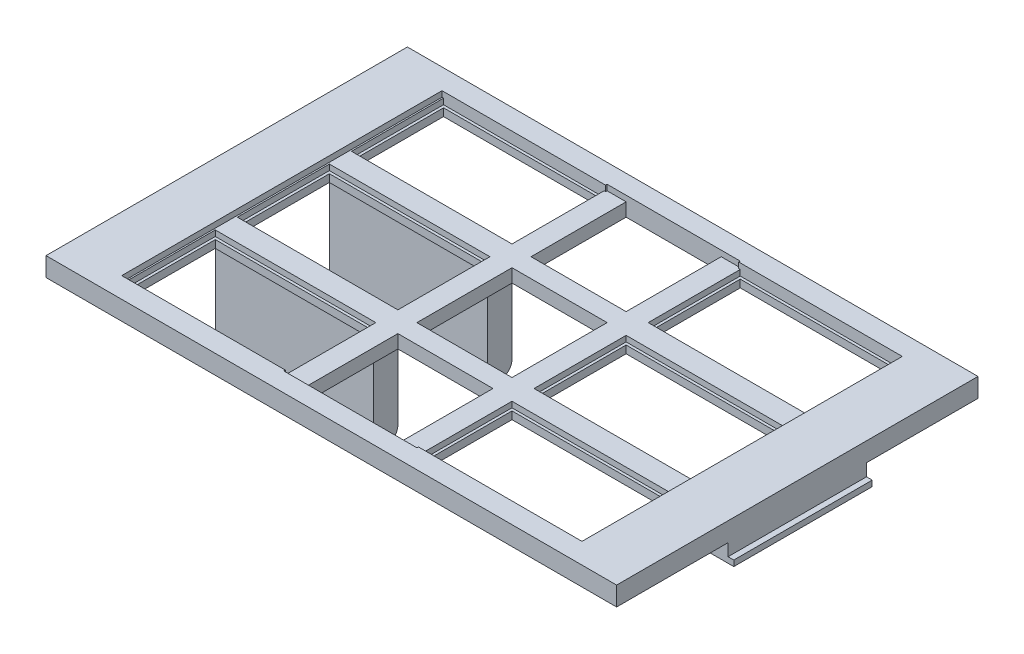
from build123d import *

# Parameters (mm, degrees)
SKETCH1_W            = 140
SKETCH1_H            = 95
SKETCH1_W_2          = 111
SKETCH1_H_2          = 85
BOSS_EXTRUDE1_DEPTH  = 5
SKETCH2_W            = 5
SKETCH2_H            = 85
CUT_EXTRUDE1_DEPTH   = 5
SKETCH3_W            = 25
SKETCH3_H            = 25
BOSS_EXTRUDE2_DEPTH  = 3.5
SKETCH4_W            = 43
SKETCH4_H            = 25
SKETCH4_W_2          = 41.6
SKETCH4_H_2          = 23.6
BOSS_EXTRUDE3_DEPTH  = 2
SKETCH7_W            = 5
SKETCH7_H            = 36.4
BOSS_EXTRUDE6_DEPTH  = 2.2
SKETCH8_W            = 7
SKETCH8_H            = 38.4
BOSS_EXTRUDE7_DEPTH  = 1
SKETCH9_W            = 41.6
SKETCH9_H            = 6.4
BOSS_EXTRUDE8_DEPTH  = 23
BOSS_EXTRUDE9_DEPTH  = 41.6
CUT_EXTRUDE2_DEPTH   = 3.2
SKETCH13_W           = 5
SKETCH13_H           = 95
BOSS_EXTRUDE10_DEPTH = 5
SKETCH14_W           = 5
SKETCH14_H           = 36.4
BOSS_EXTRUDE11_DEPTH = 2.2
SKETCH15_W           = 7
SKETCH15_H           = 36.4
BOSS_EXTRUDE13_DEPTH = 1
SKETCH16_W           = 1
SKETCH16_H           = 36.4
CUT_EXTRUDE3_DEPTH   = 1.5
SKETCH17_W           = 1
SKETCH17_H           = 36.4
CUT_EXTRUDE4_DEPTH   = 1.5
SKETCH18_W           = 8
SKETCH18_H           = 36.4
BOSS_EXTRUDE14_DEPTH = 1.5
SKETCH19_W           = 43
SKETCH19_H           = 0.4
BOSS_EXTRUDE15_DEPTH = 3
SKETCH20_W           = 43
SKETCH20_H           = 0.4
CUT_EXTRUDE5_DEPTH   = 1.5
SKETCH21_W           = 0.4
SKETCH21_H           = 24.2
BOSS_EXTRUDE16_DEPTH = 1.5
SKETCH22_W           = 0.4
SKETCH22_H           = 23.6
BOSS_EXTRUDE17_DEPTH = 2
SKETCH23_W           = 40.8
SKETCH23_H           = 0.4
BOSS_EXTRUDE18_DEPTH = 2


with BuildPart() as part:
    # Sketch1 → Boss-Extrude1 (new body)
    with BuildSketch(Plane(origin=(0, 0, 0), x_dir=(1, 0, 0), z_dir=(0, 1, 0))):
        with Locations((83.563791621, 53.12756541)):
            Rectangle(SKETCH1_W, SKETCH1_H)
        with Locations((83.563791621, 53.12756541)):
            Rectangle(SKETCH1_W_2, SKETCH1_H_2, mode=Mode.SUBTRACT)
    extrude(amount=BOSS_EXTRUDE1_DEPTH)

    # Sketch2 → Cut-Extrude1 (cut)
    with BuildSketch(Plane(origin=(0, 0, 0), x_dir=(-1, 0, 0), z_dir=(0, -1, 0))):
        with Locations((-25.563791621, 53.12756541)):
            Rectangle(SKETCH2_W, SKETCH2_H)
        with Locations((-141.563791621, 53.12756541)):
            Rectangle(SKETCH2_W, SKETCH2_H)
    extrude(amount=-CUT_EXTRUDE1_DEPTH, mode=Mode.SUBTRACT)

    # Sketch3 → Boss-Extrude2 (add)
    with BuildSketch(Plane(origin=(0, 0, 0), x_dir=(-1, 0, 0), z_dir=(0, -1, 0))):
        Polygon((-144.063791621, 65.62756541), (-101.063791621, 65.62756541), (-101.063791621, 40.62756541), (-144.063791621, 40.62756541), (-144.063791621, 35.62756541), (-101.063791621, 35.62756541), (-101.063791621, 10.62756541), (-96.063791621, 10.62756541), (-96.063791621, 35.62756541), (-71.063791621, 35.62756541), (-71.063791621, 10.62756541), (-66.063791621, 10.62756541), (-66.063791621, 35.62756541), (-23.063791621, 35.62756541), (-23.063791621, 40.62756541), (-66.063791621, 40.62756541), (-66.063791621, 65.62756541), (-23.063791621, 65.62756541), (-23.063791621, 70.62756541), (-66.063791621, 70.62756541), (-66.063791621, 95.62756541), (-71.063791621, 95.62756541), (-71.063791621, 70.62756541), (-96.063791621, 70.62756541), (-96.063791621, 95.62756541), (-101.063791621, 95.62756541), (-101.063791621, 70.62756541), (-144.063791621, 70.62756541), align=None)
        with Locations((-83.563791621, 53.12756541)):
            Rectangle(SKETCH3_W, SKETCH3_H, mode=Mode.SUBTRACT)
    extrude(amount=-BOSS_EXTRUDE2_DEPTH)

    # Sketch4 → Boss-Extrude3 (add)
    # profile 1 of 6: a face of its own
    with BuildSketch(Plane(origin=(0, 0, 0), x_dir=(-1, 0, 0), z_dir=(0, -1, 0))):
        with Locations((-44.563791621, 23.12756541)):
            Rectangle(SKETCH4_W, SKETCH4_H)
        with Locations((-44.563791621, 23.12756541)):
            Rectangle(SKETCH4_W_2, SKETCH4_H_2, mode=Mode.SUBTRACT)
    # profile 2 of 6: a face of its own
    with BuildSketch(Plane(origin=(0, 0, 0), x_dir=(-1, 0, 0), z_dir=(0, -1, 0))):
        with Locations((-44.563791621, 83.12756541)):
            Rectangle(SKETCH4_W, SKETCH4_H)
        with Locations((-44.563791621, 83.12756541)):
            Rectangle(SKETCH4_W_2, SKETCH4_H_2, mode=Mode.SUBTRACT)
    # profile 3 of 6: a face of its own
    with BuildSketch(Plane(origin=(0, 0, 0), x_dir=(-1, 0, 0), z_dir=(0, -1, 0))):
        with Locations((-122.563791621, 23.12756541)):
            Rectangle(SKETCH4_W, SKETCH4_H)
        with Locations((-122.563791621, 23.12756541)):
            Rectangle(SKETCH4_W_2, SKETCH4_H_2, mode=Mode.SUBTRACT)
    # profile 4 of 6: a face of its own
    with BuildSketch(Plane(origin=(0, 0, 0), x_dir=(-1, 0, 0), z_dir=(0, -1, 0))):
        with Locations((-122.563791621, 83.12756541)):
            Rectangle(SKETCH4_W, SKETCH4_H)
        with Locations((-122.563791621, 83.12756541)):
            Rectangle(SKETCH4_W_2, SKETCH4_H_2, mode=Mode.SUBTRACT)
    # profile 5 of 6: a face of its own
    with BuildSketch(Plane(origin=(0, 0, 0), x_dir=(-1, 0, 0), z_dir=(0, -1, 0))):
        with Locations((-122.563791621, 53.12756541)):
            Rectangle(SKETCH4_W, SKETCH4_H)
        with Locations((-122.563791621, 53.12756541)):
            Rectangle(SKETCH4_W_2, SKETCH4_H_2, mode=Mode.SUBTRACT)
    # profile 6 of 6: a face of its own
    with BuildSketch(Plane(origin=(0, 0, 0), x_dir=(-1, 0, 0), z_dir=(0, -1, 0))):
        with Locations((-44.563791621, 53.12756541)):
            Rectangle(SKETCH4_W, SKETCH4_H)
        with Locations((-44.563791621, 53.12756541)):
            Rectangle(SKETCH4_W_2, SKETCH4_H_2, mode=Mode.SUBTRACT)
    extrude(amount=-BOSS_EXTRUDE3_DEPTH)

    # Sketch7 → Boss-Extrude6 (add)
    with BuildSketch(Plane(origin=(0, 0, 0), x_dir=(-1, 0, 0), z_dir=(0, -1, 0))):
        with Locations((-16.063791621, 53.12756541)):
            Rectangle(SKETCH7_W, SKETCH7_H)
        with Locations((-151.063791621, 53.12756541)):
            Rectangle(SKETCH7_W, SKETCH7_H)
    extrude(amount=BOSS_EXTRUDE6_DEPTH)

    # Sketch8 → Boss-Extrude7 (add)
    with BuildSketch(Plane(origin=(0, -2.2, 0), x_dir=(-1, 0, 0), z_dir=(0, -1, 0))):
        with Locations((-16.063791621, 53.12756541)):
            Rectangle(SKETCH8_W, SKETCH8_H)
        with Locations((-151.063791621, 53.12756541)):
            Rectangle(SKETCH8_W, SKETCH8_H)
    extrude(amount=BOSS_EXTRUDE7_DEPTH)

    # Sketch9 → Boss-Extrude8 (add)
    with BuildSketch(Plane(origin=(0, 0, 0), x_dir=(-1, 0, 0), z_dir=(0, -1, 0))):
        with Locations((-44.563791621, 38.12756541)):
            Rectangle(SKETCH9_W, SKETCH9_H)
        with Locations((-44.563791621, 68.12756541)):
            Rectangle(SKETCH9_W, SKETCH9_H)
    extrude(amount=BOSS_EXTRUDE8_DEPTH)

    # Sketch10 → Boss-Extrude9 (add)
    with BuildSketch(Plane.ZY.offset(-23.763791621)):
        with BuildLine():
            Line((-34.92756541, -23), (-41.32756541, -23))
            ThreePointArc((-41.32756541, -23), (-38.12756541, -26.2), (-34.92756541, -23))
        make_face()
        with BuildLine():
            Line((-64.92756541, -23), (-71.32756541, -23))
            ThreePointArc((-71.32756541, -23), (-68.12756541, -26.2), (-64.92756541, -23))
        make_face()
    extrude(amount=-BOSS_EXTRUDE9_DEPTH)

    # Sketch11 → Cut-Extrude2 (cut)
    with BuildSketch(Plane(origin=(0, -3.2, 0), x_dir=(-1, 0, 0), z_dir=(0, -1, 0))):
        Polygon((4.731224124, 21.307801326), (0, 88.568907634), (-22.49756263, 88.568907634), (-22.49756263, 20.976895931), align=None)
        Polygon((-171.539261376, 88.568907634), (-162.261867402, 19.278371394), (-145.542505007, 19.48155809), (-145.542505007, 88.568907634), align=None)
    extrude(amount=-CUT_EXTRUDE2_DEPTH, mode=Mode.SUBTRACT)

    # Sketch13 → Boss-Extrude10 (add)
    with BuildSketch(Plane(origin=(0, 0, 0), x_dir=(-1, 0, 0), z_dir=(0, -1, 0))):
        with Locations((-11.063791621, 53.12756541)):
            Rectangle(SKETCH13_W, SKETCH13_H)
        with Locations((-156.063791621, 53.12756541)):
            Rectangle(SKETCH13_W, SKETCH13_H)
    extrude(amount=-BOSS_EXTRUDE10_DEPTH)

    # Sketch14 → Boss-Extrude11 (add)
    with BuildSketch(Plane(origin=(0, 0, 0), x_dir=(-1, 0, 0), z_dir=(0, -1, 0))):
        with Locations((-11.063791621, 53.12756541)):
            Rectangle(SKETCH14_W, SKETCH14_H)
        with Locations((-156.063791621, 53.12756541)):
            Rectangle(SKETCH14_W, SKETCH14_H)
    extrude(amount=BOSS_EXTRUDE11_DEPTH)

    # Sketch15 → Boss-Extrude13 (add)
    with BuildSketch(Plane(origin=(0, -2.2, 0), x_dir=(-1, 0, 0), z_dir=(0, -1, 0))):
        with Locations((-156.063791621, 53.12756541)):
            Rectangle(SKETCH15_W, SKETCH15_H)
        with Locations((-11.063791621, 53.12756541)):
            Rectangle(SKETCH15_W, SKETCH15_H)
    extrude(amount=BOSS_EXTRUDE13_DEPTH)

    # Sketch16 → Cut-Extrude3 (cut)
    with BuildSketch(Plane(origin=(158.563791621, -2.2, -71.32756541), x_dir=(1, 0, 0), z_dir=(0, 1, 0))):
        with Locations((0.5, -18.2)):
            Rectangle(SKETCH16_W, SKETCH16_H)
        with Locations((-5.5, -18.2)):
            Rectangle(SKETCH16_W, SKETCH16_H)
    extrude(amount=-CUT_EXTRUDE3_DEPTH, mode=Mode.SUBTRACT)

    # Sketch17 → Cut-Extrude4 (cut)
    with BuildSketch(Plane(origin=(0, -3.2, 0), x_dir=(-1, 0, 0), z_dir=(0, -1, 0))):
        with Locations((-8.063791621, 53.12756541)):
            Rectangle(SKETCH17_W, SKETCH17_H)
        with Locations((-14.063791621, 53.12756541)):
            Rectangle(SKETCH17_W, SKETCH17_H)
    extrude(amount=-CUT_EXTRUDE4_DEPTH, mode=Mode.SUBTRACT)

    # Sketch18 → Boss-Extrude14 (add)
    with BuildSketch(Plane(origin=(0, -3.2, 0), x_dir=(-1, 0, 0), z_dir=(0, -1, 0))):
        with Locations((-11.063791621, 53.12756541)):
            Rectangle(SKETCH18_W, SKETCH18_H)
        with Locations((-156.063791621, 53.12756541)):
            Rectangle(SKETCH18_W, SKETCH18_H)
    extrude(amount=BOSS_EXTRUDE14_DEPTH)

    # Sketch19 → Boss-Extrude15 (add)
    with BuildSketch(Plane(origin=(0, 2, 0), x_dir=(1, 0, 0), z_dir=(0, 1, 0))):
        with Locations((44.563791621, 95.42756541)):
            Rectangle(SKETCH19_W, SKETCH19_H)
        with Locations((122.563791621, 95.42756541)):
            Rectangle(SKETCH19_W, SKETCH19_H)
        with Locations((44.563791621, 70.82756541)):
            Rectangle(SKETCH19_W, SKETCH19_H)
        with Locations((122.563791621, 70.82756541)):
            Rectangle(SKETCH19_W, SKETCH19_H)
        with Locations((122.563791621, 65.42756541)):
            Rectangle(SKETCH19_W, SKETCH19_H)
        with Locations((122.563791621, 40.82756541)):
            Rectangle(SKETCH19_W, SKETCH19_H)
        with Locations((122.563791621, 35.42756541)):
            Rectangle(SKETCH19_W, SKETCH19_H)
        with Locations((122.563791621, 10.82756541)):
            Rectangle(SKETCH19_W, SKETCH19_H)
        with Locations((44.563791621, 35.42756541)):
            Rectangle(SKETCH19_W, SKETCH19_H)
        with Locations((44.563791621, 10.82756541)):
            Rectangle(SKETCH19_W, SKETCH19_H)
        with Locations((44.563791621, 65.42756541)):
            Rectangle(SKETCH19_W, SKETCH19_H)
        with Locations((44.563791621, 40.82756541)):
            Rectangle(SKETCH19_W, SKETCH19_H)
    extrude(amount=BOSS_EXTRUDE15_DEPTH)

    # Sketch20 → Cut-Extrude5 (cut)
    with BuildSketch(Plane(origin=(0, 5, 0), x_dir=(1, 0, 0), z_dir=(0, 1, 0))):
        with Locations((44.563791621, 70.82756541)):
            Rectangle(SKETCH20_W, SKETCH20_H)
        with Locations((44.563791621, 65.42756541)):
            Rectangle(SKETCH20_W, SKETCH20_H)
        with Locations((122.563791621, 70.82756541)):
            Rectangle(SKETCH20_W, SKETCH20_H)
        with Locations((122.563791621, 65.42756541)):
            Rectangle(SKETCH20_W, SKETCH20_H)
        with Locations((122.563791621, 40.82756541)):
            Rectangle(SKETCH20_W, SKETCH20_H)
        with Locations((122.563791621, 35.42756541)):
            Rectangle(SKETCH20_W, SKETCH20_H)
        with Locations((44.563791621, 35.42756541)):
            Rectangle(SKETCH20_W, SKETCH20_H)
        with Locations((44.563791621, 40.82756541)):
            Rectangle(SKETCH20_W, SKETCH20_H)
    extrude(amount=-CUT_EXTRUDE5_DEPTH, mode=Mode.SUBTRACT)

    # Sketch21 → Boss-Extrude16 (add)
    with BuildSketch(Plane(origin=(0, 2, 0), x_dir=(1, 0, 0), z_dir=(0, 1, 0))):
        with Locations((65.863791621, 83.12756541)):
            Rectangle(SKETCH21_W, SKETCH21_H)
        with Locations((23.263791621, 83.12756541)):
            Rectangle(SKETCH21_W, SKETCH21_H)
        with Locations((143.863791621, 83.12756541)):
            Rectangle(SKETCH21_W, SKETCH21_H)
        with Locations((101.263791621, 83.12756541)):
            Rectangle(SKETCH21_W, SKETCH21_H)
        with Locations((143.863791621, 53.12756541)):
            Rectangle(SKETCH21_W, SKETCH21_H)
        with Locations((101.263791621, 53.12756541)):
            Rectangle(SKETCH21_W, SKETCH21_H)
        with Locations((143.863791621, 23.12756541)):
            Rectangle(SKETCH21_W, SKETCH21_H)
        with Locations((101.263791621, 23.12756541)):
            Rectangle(SKETCH21_W, SKETCH21_H)
        with Locations((65.863791621, 23.12756541)):
            Rectangle(SKETCH21_W, SKETCH21_H)
        with Locations((23.263791621, 23.12756541)):
            Rectangle(SKETCH21_W, SKETCH21_H)
        with Locations((65.863791621, 53.12756541)):
            Rectangle(SKETCH21_W, SKETCH21_H)
        with Locations((23.263791621, 53.12756541)):
            Rectangle(SKETCH21_W, SKETCH21_H)
    extrude(amount=BOSS_EXTRUDE16_DEPTH)

    # Sketch22 → Boss-Extrude17 (add)
    with BuildSketch(Plane(origin=(0, 2, 0), x_dir=(1, 0, 0), z_dir=(0, 1, 0))):
        with Locations((65.163791621, 83.12756541)):
            Rectangle(SKETCH22_W, SKETCH22_H)
        with Locations((23.963791621, 83.12756541)):
            Rectangle(SKETCH22_W, SKETCH22_H)
        with Locations((143.163791621, 83.12756541)):
            Rectangle(SKETCH22_W, SKETCH22_H)
        with Locations((101.963791621, 83.12756541)):
            Rectangle(SKETCH22_W, SKETCH22_H)
        with Locations((143.163791621, 53.12756541)):
            Rectangle(SKETCH22_W, SKETCH22_H)
        with Locations((101.963791621, 53.12756541)):
            Rectangle(SKETCH22_W, SKETCH22_H)
        with Locations((143.163791621, 23.12756541)):
            Rectangle(SKETCH22_W, SKETCH22_H)
        with Locations((101.963791621, 23.12756541)):
            Rectangle(SKETCH22_W, SKETCH22_H)
        with Locations((65.163791621, 23.12756541)):
            Rectangle(SKETCH22_W, SKETCH22_H)
        with Locations((23.963791621, 23.12756541)):
            Rectangle(SKETCH22_W, SKETCH22_H)
        with Locations((65.163791621, 53.12756541)):
            Rectangle(SKETCH22_W, SKETCH22_H)
        with Locations((23.963791621, 53.12756541)):
            Rectangle(SKETCH22_W, SKETCH22_H)
    extrude(amount=-BOSS_EXTRUDE17_DEPTH)

    # Sketch23 → Boss-Extrude18 (add)
    with BuildSketch(Plane(origin=(0, 2, 0), x_dir=(1, 0, 0), z_dir=(0, 1, 0))):
        with Locations((44.563791621, 94.72756541)):
            Rectangle(SKETCH23_W, SKETCH23_H)
        with Locations((44.563791621, 71.52756541)):
            Rectangle(SKETCH23_W, SKETCH23_H)
        with Locations((122.563791621, 71.52756541)):
            Rectangle(SKETCH23_W, SKETCH23_H)
        with Locations((122.563791621, 94.72756541)):
            Rectangle(SKETCH23_W, SKETCH23_H)
        with Locations((122.563791621, 41.52756541)):
            Rectangle(SKETCH23_W, SKETCH23_H)
        with Locations((122.563791621, 64.72756541)):
            Rectangle(SKETCH23_W, SKETCH23_H)
        with Locations((122.563791621, 11.52756541)):
            Rectangle(SKETCH23_W, SKETCH23_H)
        with Locations((122.563791621, 34.72756541)):
            Rectangle(SKETCH23_W, SKETCH23_H)
        with Locations((44.563791621, 11.52756541)):
            Rectangle(SKETCH23_W, SKETCH23_H)
        with Locations((44.563791621, 34.72756541)):
            Rectangle(SKETCH23_W, SKETCH23_H)
        with Locations((44.563791621, 41.52756541)):
            Rectangle(SKETCH23_W, SKETCH23_H)
        with Locations((44.563791621, 64.72756541)):
            Rectangle(SKETCH23_W, SKETCH23_H)
    extrude(amount=-BOSS_EXTRUDE18_DEPTH)


solid = part.part
